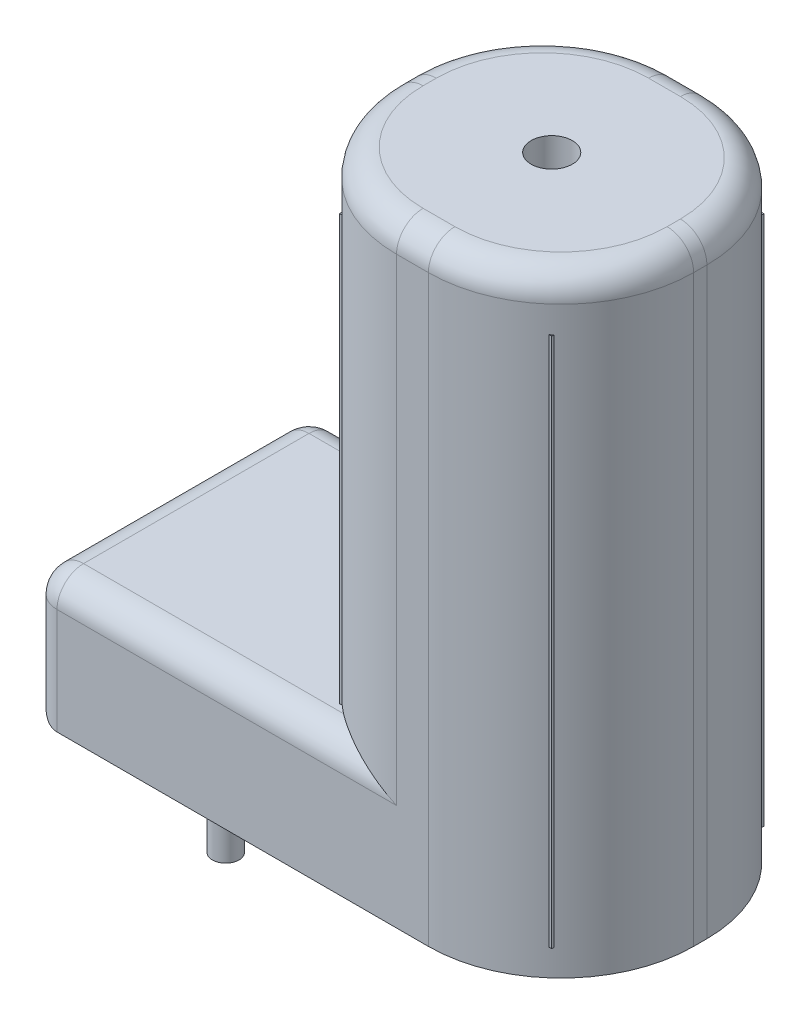
from build123d import *

# Parameters (mm, degrees)
SKETCH2_W               = 200
SKETCH2_H               = 105
SKETCH2_R               = 7.75
BOSS_EXTRUDE2_DEPTH     = 50
SKETCH3_R               = 15
CUT_EXTRUDE1_DEPTH      = 40
SKETCH4_R               = 5
BOSS_EXTRUDE3_DEPTH     = 100
SKETCH5_W               = 112
SKETCH5_H               = 105
BOSS_EXTRUDE4_DEPTH     = 180
SKETCH7_R               = 7.75
CUT_EXTRUDE2_DEPTH      = 200
CUT_EXTRUDE3_DEPTH      = 160
CUT_EXTRUDE3_DEPTH_BACK = 40
SKETCH8_W               = 80
SKETCH8_H               = 80
FILLET6_R               = 10
FILLET7_R               = 10
FILLET8_R               = 10
FILLET9_R               = 50
FILLET10_R              = 50
FILLET11_R              = 50
FILLET12_R              = 50
FILLET14_R              = 10


with BuildPart() as part:
    # Sketch2 → Boss-Extrude2 (new body)
    with BuildSketch(Plane(origin=(0, 0, 0), x_dir=(1, 0, 0), z_dir=(0, 1, 0))):
        Rectangle(SKETCH2_W, SKETCH2_H)
        with Locations(Location((44, 0, 0), (0, 0, 270))):
            Circle(SKETCH2_R, mode=Mode.SUBTRACT)
    extrude(amount=BOSS_EXTRUDE2_DEPTH)

    # Sketch3 → Cut-Extrude1 (cut)
    with BuildSketch(Plane.XZ):
        with Locations(Location((-78.898621146, 0, 0), (0, 0, 270))):
            Circle(SKETCH3_R)
    extrude(amount=-CUT_EXTRUDE1_DEPTH, mode=Mode.SUBTRACT)

    # Sketch4 → Boss-Extrude3 (add)
    with BuildSketch(Plane.XZ.offset(-40)):
        with Locations(Location((-78.898621146, 0, 0), (0, 0, 270))):
            Circle(SKETCH4_R)
    extrude(amount=BOSS_EXTRUDE3_DEPTH)

    # Sketch5 → Boss-Extrude4 (add)
    with BuildSketch(Plane(origin=(0, 50, 0), x_dir=(1, 0, 0), z_dir=(0, 1, 0))):
        with Locations((44, 0)):
            Rectangle(SKETCH5_W, SKETCH5_H)
    extrude(amount=BOSS_EXTRUDE4_DEPTH)

    # Sketch7 → Cut-Extrude2 (cut)
    with BuildSketch(Plane.XZ.offset(-50)):
        with Locations(Location((44, 0, 0), (0, 0, 90))):
            Circle(SKETCH7_R)
    extrude(amount=-CUT_EXTRUDE2_DEPTH, mode=Mode.SUBTRACT)

    # Sketch8 → Cut-Extrude3 (cut, two sides: drawn at the far end of the back side and taken through both)
    with BuildSketch(Plane(origin=(0, 50, 0), x_dir=(1, 0, 0), z_dir=(0, 1, 0)).offset(-CUT_EXTRUDE3_DEPTH_BACK)):
        with Locations((44, 0)):
            Rectangle(SKETCH8_W, SKETCH8_H)
    extrude(amount=CUT_EXTRUDE3_DEPTH + CUT_EXTRUDE3_DEPTH_BACK, mode=Mode.SUBTRACT)

    # Fillet6
    # the kernel refuses this fillet: 10 mm, written as the material it takes off along each edge
    with BuildSketch(Plane(origin=(-100, 50, 77.5), x_dir=(0, -1, 0), z_dir=(0, 0, -1))) as fillet6_piece_1:
        with BuildLine():
            CenterArc((FILLET6_R, -FILLET6_R), FILLET6_R, 90, 90)
            Line((0, -FILLET6_R), (0, 0))
            Line((0, 0), (FILLET6_R, 0))
        make_face()
    extrude(amount=155, mode=Mode.SUBTRACT)
    with BuildSketch(Plane(origin=(-100, 0, 77.5), x_dir=(0, 1, 0), z_dir=(0, 0, -1))) as fillet6_piece_2:
        with BuildLine():
            CenterArc((FILLET6_R, FILLET6_R), FILLET6_R, 180, 90)
            Line((0, FILLET6_R), (0, 0))
            Line((0, 0), (FILLET6_R, 0))
        make_face()
    extrude(amount=155, mode=Mode.SUBTRACT)
    with BuildSketch(Plane(origin=(-100, -25, 52.5), x_dir=(0, 0, -1), z_dir=(0, 1, 0)), Plane(origin=(-100, -25, -52.5), x_dir=(1, 0, 0), z_dir=(0, 1, 0))) as fillet6_piece_3:
        with BuildLine():
            CenterArc((FILLET6_R, -FILLET6_R), FILLET6_R, 90, 90)
            Line((0, -FILLET6_R), (0, 0))
            Line((0, 0), (FILLET6_R, 0))
        make_face()
    extrude(amount=100, mode=Mode.SUBTRACT)

    # Fillet7
    # the kernel refuses this fillet: 10 mm, written as the material it takes off along each edge
    with BuildSketch(Plane(origin=(-90, 40, 42.5), x_dir=(0, 0, 1), z_dir=(0, 1, 0))) as fillet7_piece_1_section:
        Polygon((0, 0), (FILLET7_R, 0), (FILLET7_R, -FILLET7_R), (0, -FILLET7_R), align=None)
    fillet7_piece_1 = extrude(amount=FILLET7_R, mode=Mode.PRIVATE)
    fillet7_piece_1 = fillet7_piece_1 - Plane(origin=(-90, 40, 42.5), x_dir=(0.7071067811865477, 0, -0.7071067811865475), z_dir=(0, 1, 0)) * Sphere(FILLET7_R, mode=Mode.PRIVATE)
    add(fillet7_piece_1, mode=Mode.SUBTRACT)
    with BuildSketch(Plane(origin=(-12, 50, 52.5), x_dir=(0, 0, -1), z_dir=(-1, 0, 0))) as fillet7_piece_2:
        with BuildLine():
            CenterArc((FILLET7_R, FILLET7_R), FILLET7_R, 180, 90)
            Line((0, FILLET7_R), (0, 0))
            Line((0, 0), (FILLET7_R, 0))
        make_face()
    extrude(amount=78, mode=Mode.SUBTRACT)

    # Fillet8
    # the kernel refuses this fillet: 10 mm, written as the material it takes off along each edge
    with BuildSketch(Plane(origin=(-90, 40, -42.5), x_dir=(0, 1, 0), z_dir=(0, 0, -1))) as fillet8_piece_1_section:
        Polygon((0, 0), (FILLET8_R, 0), (FILLET8_R, -FILLET8_R), (0, -FILLET8_R), align=None)
    fillet8_piece_1 = extrude(amount=FILLET8_R, mode=Mode.PRIVATE)
    fillet8_piece_1 = fillet8_piece_1 - Plane(origin=(-90, 40, -42.5), x_dir=(0.7071067811865475, -0.7071067811865475, 0), z_dir=(0, 0, -1)) * Sphere(FILLET8_R, mode=Mode.PRIVATE)
    add(fillet8_piece_1, mode=Mode.SUBTRACT)
    with BuildSketch(Plane(origin=(-90, 50, -52.5), x_dir=(0, -1, 0), z_dir=(1, 0, 0))) as fillet8_piece_2:
        with BuildLine():
            CenterArc((FILLET8_R, -FILLET8_R), FILLET8_R, 90, 90)
            Line((0, -FILLET8_R), (0, 0))
            Line((0, 0), (FILLET8_R, 0))
        make_face()
    extrude(amount=78, mode=Mode.SUBTRACT)

    # Fillet9
    fillet9_edges = [part.edges().sort_by_distance(p)[0] for p in [
        (100, 115, 52.5),
    ]]
    fillet(fillet9_edges, radius=FILLET9_R)

    # Fillet10
    fillet10_edges = [part.edges().sort_by_distance(p)[0] for p in [
        (-12, 135, 52.5),
    ]]
    fillet(fillet10_edges, radius=FILLET10_R)

    # Fillet11
    fillet11_edges = [part.edges().sort_by_distance(p)[0] for p in [
        (100, 115, -52.5),
    ]]
    fillet(fillet11_edges, radius=FILLET11_R)

    # Fillet12
    fillet12_edges = [part.edges().sort_by_distance(p)[0] for p in [
        (-12, 135, -52.5),
    ]]
    fillet(fillet12_edges, radius=FILLET12_R)

    # Fillet14
    fillet14_edges = [part.edges().sort_by_distance(p)[0] for p in [
        (100, 230, 0),
        (85.355339059, 230, 37.855339059),
        (44, 230, 52.5),
        (2.644660941, 230, 37.855339059),
        (44, 230, -52.5),
        (85.355339059, 230, -37.855339059),
        (-12, 230, 0),
        (2.644660941, 230, -37.855339059),
    ]]
    fillet(fillet14_edges, radius=FILLET14_R)


solid = part.part
